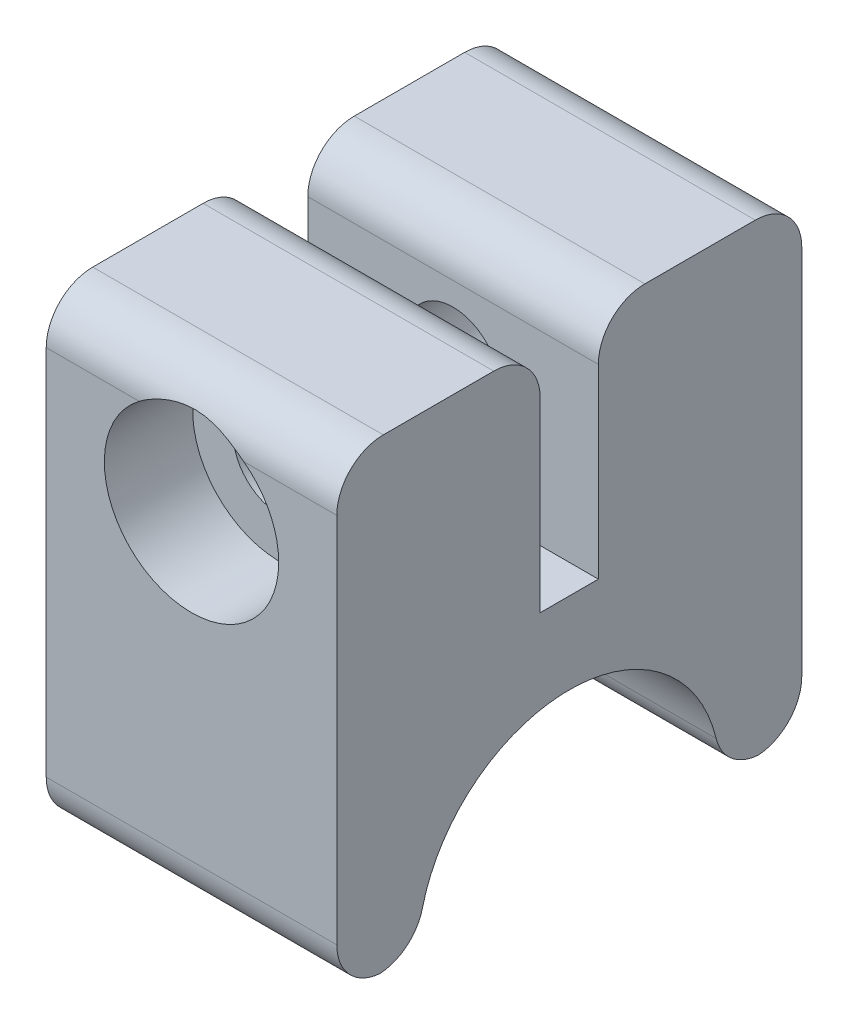
from build123d import *

# Parameters (mm, degrees)
SKETCH1_W                                       = 15.875
SKETCH1_H                                       = 25.4
BOSS_EXTRUDE1_DEPTH                             = 12.7
SKETCH2_R                                       = 8.255
SKETCH2_W                                       = 3.175
SKETCH2_H                                       = 12.7
CUT_EXTRUDE1_DEPTH                              = 24.970724332
CBORE_FOR_10_SOCKET_HEAD_CAP_SCREW1_D           = 5.1054
CBORE_FOR_10_SOCKET_HEAD_CAP_SCREW1_CBORE_D     = 9.525
CBORE_FOR_10_SOCKET_HEAD_CAP_SCREW1_CBORE_DEPTH = 4.826
FILLET2_R                                       = 2.54
CUT_EXTRUDE2_DEPTH                              = 6.207125


with BuildPart() as part:
    # Sketch1 → Boss-Extrude1 (new, symmetric)
    with BuildSketch(Plane.XY):
        Rectangle(SKETCH1_W, SKETCH1_H)
    extrude(amount=BOSS_EXTRUDE1_DEPTH, both=True)

    # Sketch2 → Cut-Extrude1 (cut, through all)
    with BuildSketch(Plane(origin=(7.9375, 0, 0), x_dir=(0, 0, -1), z_dir=(1, 0, 0))):
        with Locations((0, -12.7)):
            Circle(SKETCH2_R)
        with Locations((0, 6.35)):
            Rectangle(SKETCH2_W, SKETCH2_H)
    extrude(amount=-CUT_EXTRUDE1_DEPTH, mode=Mode.SUBTRACT)

    # CBORE for #10 Socket Head Cap Screw1 (through all)
    with Locations(Plane.XY.offset(12.7)):
        with Locations((0, 6.35)):
            CounterBoreHole(CBORE_FOR_10_SOCKET_HEAD_CAP_SCREW1_D / 2, CBORE_FOR_10_SOCKET_HEAD_CAP_SCREW1_CBORE_D / 2, CBORE_FOR_10_SOCKET_HEAD_CAP_SCREW1_CBORE_DEPTH)

    # Fillet2
    # the kernel refuses this fillet: 2.54 mm, written as the material it takes off along each edge
    with BuildSketch(Plane(origin=(13.529804731, -12.7, -8.255), x_dir=(0, 0, -1), z_dir=(-1, 0, 0))) as fillet2_piece_1:
        with BuildLine():
            CenterArc((2.236921893, -2.54), FILLET2_R, 90, 76.391039369)
            ThreePointArc((-0.231765612, -1.942352941), (-0.058146187, -0.978065725), (0, 0))
            Line((0, 0), (2.236921893, 0))
        make_face()
    extrude(amount=27.059609463, mode=Mode.SUBTRACT)
    with BuildSketch(Plane(origin=(-13.529804731, -12.7, 8.255), x_dir=(0, 0.9929562463238144, -0.11848161412860811), z_dir=(1, 0, 0))) as fillet2_piece_2:
        with BuildLine():
            CenterArc((2.257074749, 2.522108866), FILLET2_R, 186.804480315, 76.391039369)
            Line((-0.265034117, 2.221165566), (0, 0))
            ThreePointArc((0, 0), (0.978065725, 0.058146187), (1.956131449, 0))
        make_face()
    extrude(amount=27.059609463, mode=Mode.SUBTRACT)
    with BuildSketch(Plane(origin=(14.2875, 12.7, 12.7), x_dir=(0, 0, -1), z_dir=(-1, 0, 0)), Plane(origin=(14.2875, 12.7, -12.7), x_dir=(0, -1, 0), z_dir=(-1, 0, 0)), Plane(origin=(14.2875, 12.7, -1.5875), x_dir=(0, 0, -1), z_dir=(-1, 0, 0)), Plane(origin=(14.2875, 12.7, 1.5875), x_dir=(0, -1, 0), z_dir=(-1, 0, 0))) as fillet2_piece_3:
        with BuildLine():
            CenterArc((FILLET2_R, FILLET2_R), FILLET2_R, 180, 90)
            Line((0, FILLET2_R), (0, 0))
            Line((0, 0), (FILLET2_R, 0))
        make_face()
    extrude(amount=28.575, mode=Mode.SUBTRACT)
    with BuildSketch(Plane(origin=(-14.2875, -12.7, 12.7), x_dir=(0, 1, 0), z_dir=(1, 0, 0)), Plane(origin=(-14.2875, -12.7, -12.7), x_dir=(0, 0, 1), z_dir=(1, 0, 0))) as fillet2_piece_4:
        with BuildLine():
            CenterArc((FILLET2_R, -FILLET2_R), FILLET2_R, 90, 90)
            Line((0, -FILLET2_R), (0, 0))
            Line((0, 0), (FILLET2_R, 0))
        make_face()
    extrude(amount=28.575, mode=Mode.SUBTRACT)

    # Sketch5 → Cut-Extrude2 (cut)
    with BuildSketch(Plane(origin=(0, 0, -12.7), x_dir=(-1, 0, 0), z_dir=(0, 0, -1))):
        Polygon((5.645908282, 6.35), (2.822954141, 11.2395), (-2.822954141, 11.2395), (-5.645908282, 6.35), (-2.822954141, 1.4605), (2.822954141, 1.4605), align=None)
    extrude(amount=-CUT_EXTRUDE2_DEPTH, mode=Mode.SUBTRACT)


solid = part.part
